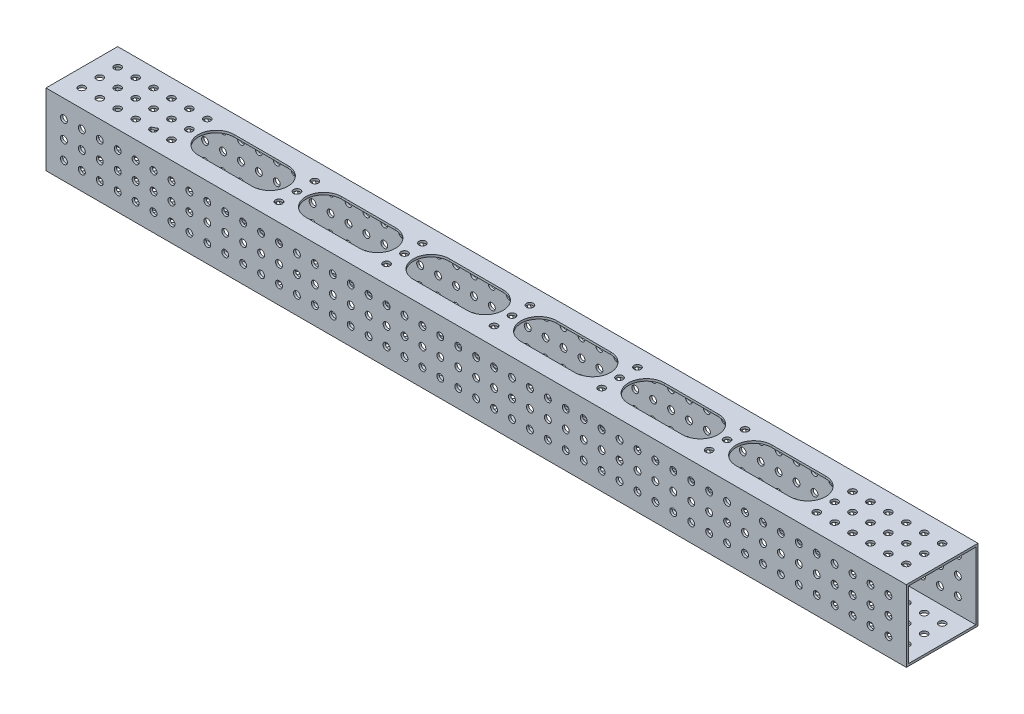
from build123d import *

# Parameters (mm, degrees)
SKETCH1_W           = 50.8
SKETCH1_H           = 50.8
SKETCH1_W_2         = 47.625
SKETCH1_H_2         = 47.625
BOSS_EXTRUDE1_DEPTH = 609.6
SKETCH2_R           = 2.4384
CUT_EXTRUDE2_DEPTH  = 609.6
SKETCH3_R           = 2.4384
CUT_EXTRUDE3_DEPTH  = 76.2


with BuildPart() as part:
    # Sketch1 → Boss-Extrude1 (new body)
    with BuildSketch(Plane(origin=(0, 0, 0), x_dir=(0, 0, -1), z_dir=(1, 0, 0))):
        Rectangle(SKETCH1_W, SKETCH1_H)
        Rectangle(SKETCH1_W_2, SKETCH1_H_2, mode=Mode.SUBTRACT)
    extrude(amount=BOSS_EXTRUDE1_DEPTH)

    # Sketch2 → Cut-Extrude2 (cut)
    with BuildSketch(Plane.XY.offset(25.4)):
        with Locations((12.7, 12.7)):
            Circle(SKETCH2_R)
        with Locations((12.7, 0)):
            Circle(SKETCH2_R)
        with Locations((12.7, -12.7)):
            Circle(SKETCH2_R)
        with Locations((25.4, 12.7)):
            Circle(SKETCH2_R)
        with Locations((25.4, 0)):
            Circle(SKETCH2_R)
        with Locations((25.4, -12.7)):
            Circle(SKETCH2_R)
        with Locations((38.1, 12.7)):
            Circle(SKETCH2_R)
        with Locations((38.1, 0)):
            Circle(SKETCH2_R)
        with Locations((38.1, -12.7)):
            Circle(SKETCH2_R)
        with Locations((50.8, 12.7)):
            Circle(SKETCH2_R)
        with Locations((50.8, 0)):
            Circle(SKETCH2_R)
        with Locations((50.8, -12.7)):
            Circle(SKETCH2_R)
        with Locations((63.5, 12.7)):
            Circle(SKETCH2_R)
        with Locations((63.5, 0)):
            Circle(SKETCH2_R)
        with Locations((63.5, -12.7)):
            Circle(SKETCH2_R)
        with Locations((76.2, 12.7)):
            Circle(SKETCH2_R)
        with Locations((76.2, 0)):
            Circle(SKETCH2_R)
        with Locations((76.2, -12.7)):
            Circle(SKETCH2_R)
        with Locations((88.9, 12.7)):
            Circle(SKETCH2_R)
        with Locations((88.9, 0)):
            Circle(SKETCH2_R)
        with Locations((88.9, -12.7)):
            Circle(SKETCH2_R)
        with Locations((101.6, 12.7)):
            Circle(SKETCH2_R)
        with Locations((101.6, 0)):
            Circle(SKETCH2_R)
        with Locations((101.6, -12.7)):
            Circle(SKETCH2_R)
        with Locations((114.3, 12.7)):
            Circle(SKETCH2_R)
        with Locations((114.3, 0)):
            Circle(SKETCH2_R)
        with Locations((114.3, -12.7)):
            Circle(SKETCH2_R)
        with Locations((127, 12.7)):
            Circle(SKETCH2_R)
        with Locations((127, 0)):
            Circle(SKETCH2_R)
        with Locations((127, -12.7)):
            Circle(SKETCH2_R)
        with Locations((139.7, 12.7)):
            Circle(SKETCH2_R)
        with Locations((139.7, 0)):
            Circle(SKETCH2_R)
        with Locations((139.7, -12.7)):
            Circle(SKETCH2_R)
        with Locations((152.4, 12.7)):
            Circle(SKETCH2_R)
        with Locations((152.4, 0)):
            Circle(SKETCH2_R)
        with Locations((152.4, -12.7)):
            Circle(SKETCH2_R)
        with Locations((165.1, 12.7)):
            Circle(SKETCH2_R)
        with Locations((165.1, 0)):
            Circle(SKETCH2_R)
        with Locations((165.1, -12.7)):
            Circle(SKETCH2_R)
        with Locations((177.8, 12.7)):
            Circle(SKETCH2_R)
        with Locations((177.8, 0)):
            Circle(SKETCH2_R)
        with Locations((177.8, -12.7)):
            Circle(SKETCH2_R)
        with Locations((190.5, 12.7)):
            Circle(SKETCH2_R)
        with Locations((190.5, 0)):
            Circle(SKETCH2_R)
        with Locations((190.5, -12.7)):
            Circle(SKETCH2_R)
        with Locations((203.2, 12.7)):
            Circle(SKETCH2_R)
        with Locations((203.2, 0)):
            Circle(SKETCH2_R)
        with Locations((203.2, -12.7)):
            Circle(SKETCH2_R)
        with Locations((215.9, 12.7)):
            Circle(SKETCH2_R)
        with Locations((215.9, 0)):
            Circle(SKETCH2_R)
        with Locations((215.9, -12.7)):
            Circle(SKETCH2_R)
        with Locations((228.6, 12.7)):
            Circle(SKETCH2_R)
        with Locations((228.6, 0)):
            Circle(SKETCH2_R)
        with Locations((228.6, -12.7)):
            Circle(SKETCH2_R)
        with Locations((241.3, 12.7)):
            Circle(SKETCH2_R)
        with Locations((241.3, 0)):
            Circle(SKETCH2_R)
        with Locations((241.3, -12.7)):
            Circle(SKETCH2_R)
        with Locations((254, 12.7)):
            Circle(SKETCH2_R)
        with Locations((254, 0)):
            Circle(SKETCH2_R)
        with Locations((254, -12.7)):
            Circle(SKETCH2_R)
        with Locations((266.7, 12.7)):
            Circle(SKETCH2_R)
        with Locations((266.7, 0)):
            Circle(SKETCH2_R)
        with Locations((266.7, -12.7)):
            Circle(SKETCH2_R)
        with Locations((279.4, 12.7)):
            Circle(SKETCH2_R)
        with Locations((279.4, 0)):
            Circle(SKETCH2_R)
        with Locations((279.4, -12.7)):
            Circle(SKETCH2_R)
        with Locations((292.1, 12.7)):
            Circle(SKETCH2_R)
        with Locations((292.1, 0)):
            Circle(SKETCH2_R)
        with Locations((292.1, -12.7)):
            Circle(SKETCH2_R)
        with Locations((304.8, 12.7)):
            Circle(SKETCH2_R)
        with Locations((304.8, 0)):
            Circle(SKETCH2_R)
        with Locations((304.8, -12.7)):
            Circle(SKETCH2_R)
        with Locations((317.5, 12.7)):
            Circle(SKETCH2_R)
        with Locations((317.5, 0)):
            Circle(SKETCH2_R)
        with Locations((317.5, -12.7)):
            Circle(SKETCH2_R)
        with Locations((330.2, 12.7)):
            Circle(SKETCH2_R)
        with Locations((330.2, 0)):
            Circle(SKETCH2_R)
        with Locations((330.2, -12.7)):
            Circle(SKETCH2_R)
        with Locations((342.9, 12.7)):
            Circle(SKETCH2_R)
        with Locations((342.9, 0)):
            Circle(SKETCH2_R)
        with Locations((342.9, -12.7)):
            Circle(SKETCH2_R)
        with Locations((355.6, 12.7)):
            Circle(SKETCH2_R)
        with Locations((355.6, 0)):
            Circle(SKETCH2_R)
        with Locations((355.6, -12.7)):
            Circle(SKETCH2_R)
        with Locations((368.3, 12.7)):
            Circle(SKETCH2_R)
        with Locations((368.3, 0)):
            Circle(SKETCH2_R)
        with Locations((368.3, -12.7)):
            Circle(SKETCH2_R)
        with Locations((381, 12.7)):
            Circle(SKETCH2_R)
        with Locations((381, 0)):
            Circle(SKETCH2_R)
        with Locations((381, -12.7)):
            Circle(SKETCH2_R)
        with Locations((393.7, 12.7)):
            Circle(SKETCH2_R)
        with Locations((393.7, 0)):
            Circle(SKETCH2_R)
        with Locations((393.7, -12.7)):
            Circle(SKETCH2_R)
        with Locations((406.4, 12.7)):
            Circle(SKETCH2_R)
        with Locations((406.4, 0)):
            Circle(SKETCH2_R)
        with Locations((406.4, -12.7)):
            Circle(SKETCH2_R)
        with Locations((419.1, 12.7)):
            Circle(SKETCH2_R)
        with Locations((419.1, 0)):
            Circle(SKETCH2_R)
        with Locations((419.1, -12.7)):
            Circle(SKETCH2_R)
        with Locations((431.8, 12.7)):
            Circle(SKETCH2_R)
        with Locations((431.8, 0)):
            Circle(SKETCH2_R)
        with Locations((431.8, -12.7)):
            Circle(SKETCH2_R)
        with Locations((444.5, 12.7)):
            Circle(SKETCH2_R)
        with Locations((444.5, 0)):
            Circle(SKETCH2_R)
        with Locations((444.5, -12.7)):
            Circle(SKETCH2_R)
        with Locations((457.2, 12.7)):
            Circle(SKETCH2_R)
        with Locations((457.2, 0)):
            Circle(SKETCH2_R)
        with Locations((457.2, -12.7)):
            Circle(SKETCH2_R)
        with Locations((469.9, 12.7)):
            Circle(SKETCH2_R)
        with Locations((469.9, 0)):
            Circle(SKETCH2_R)
        with Locations((469.9, -12.7)):
            Circle(SKETCH2_R)
        with Locations((482.6, 12.7)):
            Circle(SKETCH2_R)
        with Locations((482.6, 0)):
            Circle(SKETCH2_R)
        with Locations((482.6, -12.7)):
            Circle(SKETCH2_R)
        with Locations((495.3, 12.7)):
            Circle(SKETCH2_R)
        with Locations((495.3, 0)):
            Circle(SKETCH2_R)
        with Locations((495.3, -12.7)):
            Circle(SKETCH2_R)
        with Locations((508, 12.7)):
            Circle(SKETCH2_R)
        with Locations((508, 0)):
            Circle(SKETCH2_R)
        with Locations((508, -12.7)):
            Circle(SKETCH2_R)
        with Locations((520.7, 12.7)):
            Circle(SKETCH2_R)
        with Locations((520.7, 0)):
            Circle(SKETCH2_R)
        with Locations((520.7, -12.7)):
            Circle(SKETCH2_R)
        with Locations((533.4, 12.7)):
            Circle(SKETCH2_R)
        with Locations((533.4, 0)):
            Circle(SKETCH2_R)
        with Locations((533.4, -12.7)):
            Circle(SKETCH2_R)
        with Locations((546.1, 12.7)):
            Circle(SKETCH2_R)
        with Locations((546.1, 0)):
            Circle(SKETCH2_R)
        with Locations((546.1, -12.7)):
            Circle(SKETCH2_R)
        with Locations((558.8, 12.7)):
            Circle(SKETCH2_R)
        with Locations((558.8, 0)):
            Circle(SKETCH2_R)
        with Locations((558.8, -12.7)):
            Circle(SKETCH2_R)
        with Locations((571.5, 12.7)):
            Circle(SKETCH2_R)
        with Locations((571.5, 0)):
            Circle(SKETCH2_R)
        with Locations((571.5, -12.7)):
            Circle(SKETCH2_R)
        with Locations((584.2, 12.7)):
            Circle(SKETCH2_R)
        with Locations((584.2, 0)):
            Circle(SKETCH2_R)
        with Locations((584.2, -12.7)):
            Circle(SKETCH2_R)
        with Locations((596.9, 12.7)):
            Circle(SKETCH2_R)
        with Locations((596.9, 0)):
            Circle(SKETCH2_R)
        with Locations((596.9, -12.7)):
            Circle(SKETCH2_R)
    extrude(amount=-CUT_EXTRUDE2_DEPTH, mode=Mode.SUBTRACT)

    # Sketch3 → Cut-Extrude3 (cut)
    with BuildSketch(Plane.XZ.offset(25.4)):
        with BuildLine():
            ThreePointArc((400.05, 12.7), (387.35, 0), (400.05, -12.7))
            Line((400.05, -12.7), (438.15, -12.7))
            ThreePointArc((438.15, -12.7), (450.85, 0), (438.15, 12.7))
            Line((438.15, 12.7), (400.05, 12.7))
        make_face()
        with Locations((381, 0)):
            Circle(SKETCH3_R)
        with BuildLine():
            ThreePointArc((323.85, 12.7), (311.15, 0), (323.85, -12.7))
            Line((323.85, -12.7), (361.95, -12.7))
            ThreePointArc((361.95, -12.7), (374.65, 0), (361.95, 12.7))
            Line((361.95, 12.7), (323.85, 12.7))
        make_face()
        with Locations((304.8, 0)):
            Circle(SKETCH3_R)
        with BuildLine():
            ThreePointArc((247.65, 12.7), (234.95, 0), (247.65, -12.7))
            Line((247.65, -12.7), (285.75, -12.7))
            ThreePointArc((285.75, -12.7), (298.45, 0), (285.75, 12.7))
            Line((285.75, 12.7), (247.65, 12.7))
        make_face()
        with Locations((228.6, 0)):
            Circle(SKETCH3_R)
        with BuildLine():
            ThreePointArc((171.45, 12.7), (158.75, 0), (171.45, -12.7))
            Line((171.45, -12.7), (209.55, -12.7))
            ThreePointArc((209.55, -12.7), (222.25, 0), (209.55, 12.7))
            Line((209.55, 12.7), (171.45, 12.7))
        make_face()
        with Locations((152.4, 0)):
            Circle(SKETCH3_R)
        with BuildLine():
            ThreePointArc((95.25, 12.7), (82.55, 0), (95.25, -12.7))
            Line((95.25, -12.7), (133.35, -12.7))
            ThreePointArc((133.35, -12.7), (146.05, 0), (133.35, 12.7))
            Line((133.35, 12.7), (95.25, 12.7))
        make_face()
        with Locations((76.2, 0)):
            Circle(SKETCH3_R)
        with Locations((50.8, 12.7)):
            Circle(SKETCH3_R)
        with BuildLine():
            ThreePointArc((64.394018317, 10.431404441), (64.590485631, 14.880971263), (61.148712563, 12.054057319))
            ThreePointArc((61.148712563, 12.054057319), (62.829612663, 11.359225326), (64.394018317, 10.431404441))
        make_face()
        with Locations((38.1, 12.7)):
            Circle(SKETCH3_R)
        with Locations((25.4, 12.7)):
            Circle(SKETCH3_R)
        with Locations((63.5, -12.7)):
            Circle(SKETCH3_R)
        with Locations((12.7, 12.7)):
            Circle(SKETCH3_R)
        with Locations((50.8, -12.7)):
            Circle(SKETCH3_R)
        with Locations((38.1, -12.7)):
            Circle(SKETCH3_R)
        with Locations((12.7, -12.7)):
            Circle(SKETCH3_R)
        with Locations((25.4, -12.7)):
            Circle(SKETCH3_R)
        with Locations((533.4, 0)):
            Circle(SKETCH3_R)
        with Locations((457.2, 0)):
            Circle(SKETCH3_R)
        with BuildLine():
            Line((514.35, 12.7), (476.25, 12.7))
            ThreePointArc((476.25, 12.7), (463.55, 0), (476.25, -12.7))
            Line((476.25, -12.7), (514.35, -12.7))
            ThreePointArc((514.35, -12.7), (527.05, 0), (514.35, 12.7))
        make_face()
        with Locations((546.1, 12.7)):
            Circle(SKETCH3_R)
        with Locations((546.1, -12.7)):
            Circle(SKETCH3_R)
        with Locations((558.8, 12.7)):
            Circle(SKETCH3_R)
        with Locations((558.8, -12.7)):
            Circle(SKETCH3_R)
        with Locations((571.5, 12.7)):
            Circle(SKETCH3_R)
        with Locations((571.5, -12.7)):
            Circle(SKETCH3_R)
        with Locations((584.2, 12.7)):
            Circle(SKETCH3_R)
        with Locations((584.2, -12.7)):
            Circle(SKETCH3_R)
        with Locations((596.9, 12.7)):
            Circle(SKETCH3_R)
        with Locations((596.9, -12.7)):
            Circle(SKETCH3_R)
        with Locations((76.2, 12.7)):
            Circle(SKETCH3_R)
        with Locations((76.2, -12.7)):
            Circle(SKETCH3_R)
        with Locations((152.4, 12.7)):
            Circle(SKETCH3_R)
        with Locations((152.4, -12.7)):
            Circle(SKETCH3_R)
        with Locations((228.6, 12.7)):
            Circle(SKETCH3_R)
        with Locations((228.6, -12.7)):
            Circle(SKETCH3_R)
        with Locations((304.8, 12.7)):
            Circle(SKETCH3_R)
        with Locations((304.8, -12.7)):
            Circle(SKETCH3_R)
        with Locations((381, 12.7)):
            Circle(SKETCH3_R)
        with Locations((381, -12.7)):
            Circle(SKETCH3_R)
        with Locations((457.2, 12.7)):
            Circle(SKETCH3_R)
        with Locations((457.2, -12.7)):
            Circle(SKETCH3_R)
        with Locations((533.4, 12.7)):
            Circle(SKETCH3_R)
        with Locations((533.4, -12.7)):
            Circle(SKETCH3_R)
        with Locations((546.1, 0)):
            Circle(SKETCH3_R)
        with Locations((558.8, 0)):
            Circle(SKETCH3_R)
        with Locations((571.5, 0)):
            Circle(SKETCH3_R)
        with Locations((584.2, 0)):
            Circle(SKETCH3_R)
        with Locations((596.9, 0)):
            Circle(SKETCH3_R)
        with Locations((63.5, 0)):
            Circle(SKETCH3_R)
        with Locations((50.8, 0)):
            Circle(SKETCH3_R)
        with Locations((38.1, 0)):
            Circle(SKETCH3_R)
        with Locations((25.4, 0)):
            Circle(SKETCH3_R)
        with Locations((12.7, 0)):
            Circle(SKETCH3_R)
    extrude(amount=-CUT_EXTRUDE3_DEPTH, mode=Mode.SUBTRACT)


solid = part.part
